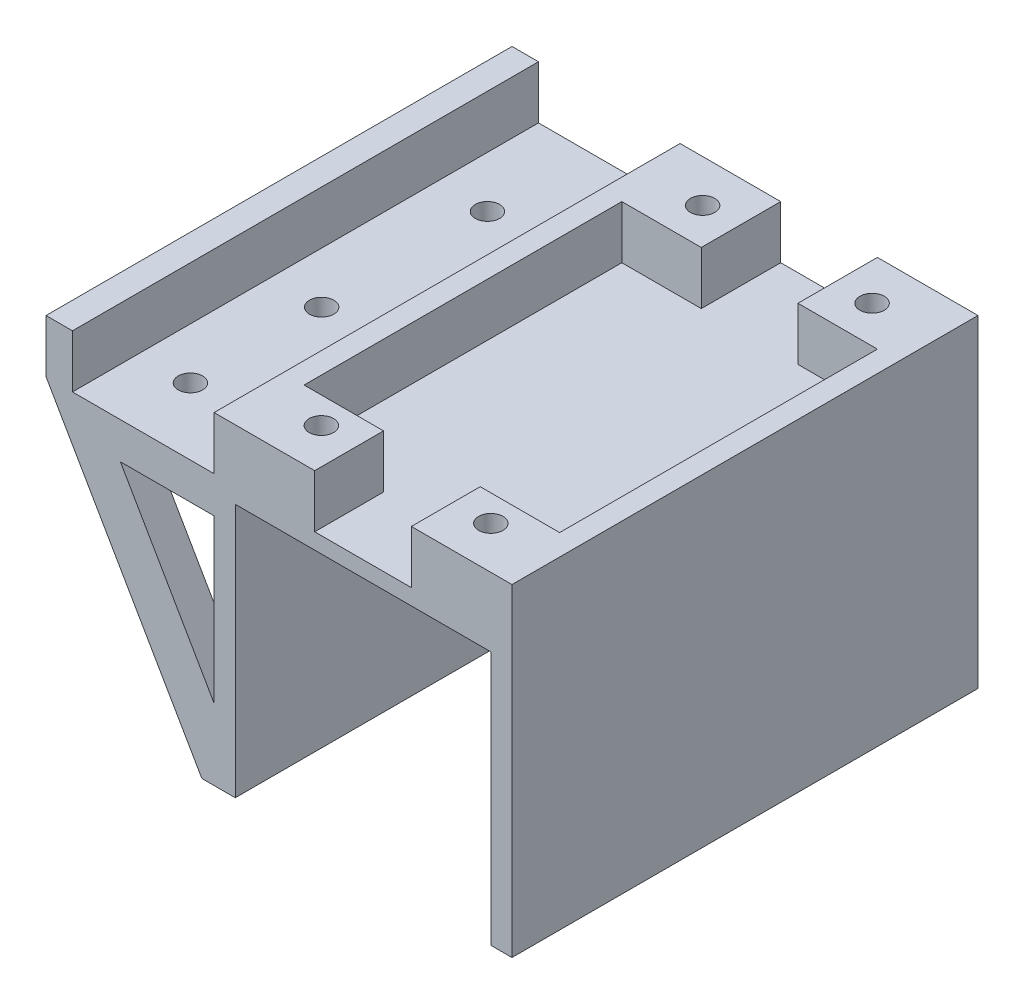
from build123d import *

# Parameters (mm, degrees)
SKETCH1_W            = 48.254
SKETCH1_H            = 10
BOSS_EXTRUDE1_DEPTH  = 70
BOSS_EXTRUDE3_DEPTH  = 8
BOSS_EXTRUDE4_DEPTH  = 8
BOSS_EXTRUDE5_DEPTH  = 8
BOSS_EXTRUDE6_DEPTH  = 70
SKETCH7_W            = 40.394634483
SKETCH7_H            = 17
CUT_EXTRUDE3_DEPTH   = 70
BOSS_EXTRUDE7_DEPTH  = 70
BOSS_EXTRUDE10_DEPTH = 8
BOSS_EXTRUDE11_DEPTH = 70
SKETCH13_W           = 83.001411072
SKETCH13_H           = 87.868559997
CUT_EXTRUDE4_DEPTH   = 4
SKETCH14_W           = 48.254
SKETCH14_H           = 10
BOSS_EXTRUDE12_DEPTH = 20
SKETCH16_W           = 56.254
SKETCH16_H           = 5
CUT_EXTRUDE5_DEPTH   = 100
SKETCH17_W           = 15
SKETCH17_H           = 15
BOSS_EXTRUDE14_DEPTH = 13
CUT_EXTRUDE8_DEPTH   = 5
SKETCH21_R           = 2.3
CUT_EXTRUDE9_DEPTH   = 15
SKETCH23_W           = 12
SKETCH23_H           = 40.530858039
CUT_EXTRUDE10_DEPTH  = 9
SKETCH25_R           = 2.3
CUT_EXTRUDE11_DEPTH  = 20
SKETCH26_R           = 2.3
CUT_EXTRUDE12_DEPTH  = 20
BOSS_EXTRUDE16_DEPTH = 20
SKETCH28_W           = 15
SKETCH28_H           = 15
BOSS_EXTRUDE17_DEPTH = 10
SKETCH29_R           = 2.3
CUT_EXTRUDE13_DEPTH  = 20
SKETCH30_W           = 10.391026801
SKETCH30_H           = 12
BOSS_EXTRUDE18_DEPTH = 5
SKETCH31_R           = 2.3
CUT_EXTRUDE14_DEPTH  = 45
SKETCH36_R           = 60.036471347
CUT_EXTRUDE15_DEPTH  = 2
SKETCH37_W           = 5
SKETCH37_H           = 88
BOSS_EXTRUDE19_DEPTH = 10


with BuildPart() as part:
    # Sketch1 → Boss-Extrude1 (new body)
    with BuildSketch(Plane.XY):
        Polygon((0, 70), (0, 0), (4, 0), (4, 52), (52.254, 52), (52.254, 0), (56.254, 0), (56.254, 70), align=None)
        with Locations((28.127, 60)):
            Rectangle(SKETCH1_W, SKETCH1_H, mode=Mode.SUBTRACT)
    extrude(amount=BOSS_EXTRUDE1_DEPTH)

    # Sketch3 → Boss-Extrude3 (add)
    with BuildSketch(Plane.XY.offset(70)):
        Polygon((0, 62.5), (0, 70), (-40.394634483, 70), (0, 0.034440722), (0, 17.466679003), (-26, 62.5), align=None)
    extrude(amount=-BOSS_EXTRUDE3_DEPTH)

    # Sketch4 → Boss-Extrude4 (add)
    with BuildSketch(Plane(origin=(0, 0, 0), x_dir=(-1, 0, 0), z_dir=(0, 0, -1))):
        Polygon((0, 70), (40.394634483, 70), (0, 0), (0, 17.466679003), (26, 62.5), (0, 62.5), align=None)
    extrude(amount=-BOSS_EXTRUDE4_DEPTH)

    # Sketch5 → Boss-Extrude5 (add)
    with BuildSketch(Plane(origin=(0, 0, 39), x_dir=(-1, 0, 0), z_dir=(0, 0, -1))):
        Polygon((0, 62.5), (0, 70), (40.394634483, 70), (0, 0), (0, 17.466679003), (26, 62.5), align=None)
    extrude(amount=BOSS_EXTRUDE5_DEPTH)

    # Sketch6 → Boss-Extrude6 (add)
    with BuildSketch(Plane(origin=(0, 0, 0), x_dir=(-1, 0, 0), z_dir=(0, 0, -1))):
        Polygon((0, 62.5), (36.066637932, 62.5), (40.394634483, 70), (0, 70), align=None)
        Polygon((-4, 0), (0, 0), (7.50186069, 13), (-4, 13), align=None)
    extrude(amount=-BOSS_EXTRUDE6_DEPTH)

    # Sketch7 → Cut-Extrude3 (cut)
    with BuildSketch(Plane.XY.offset(70)):
        with Locations((-20.197317242, 61.5)):
            Rectangle(SKETCH7_W, SKETCH7_H)
    extrude(amount=-CUT_EXTRUDE3_DEPTH, mode=Mode.SUBTRACT)

    # Sketch8 → Boss-Extrude7 (add)
    with BuildSketch(Plane(origin=(0, 0, 0), x_dir=(-1, 0, 0), z_dir=(0, 0, -1))):
        Polygon((-4, 55), (-4, 52), (30.007442759, 52), (31.73864138, 55), align=None)
    extrude(amount=-BOSS_EXTRUDE7_DEPTH)

    # Sketch11 → Boss-Extrude10 (add)
    with BuildSketch(Plane.XY.offset(70)):
        Polygon((-31.73864138, 55), (0, 0), (-3.053687451, 13), (-27.288965695, 55), align=None)
    extrude(amount=-BOSS_EXTRUDE10_DEPTH)

    # Sketch12 → Boss-Extrude11 (add)
    with BuildSketch(Plane.XY.offset(70)):
        Polygon((-31.73864138, 55), (-27.75981023, 48.105069917), (0, 48.105069917), (0, 55), align=None)
    extrude(amount=-BOSS_EXTRUDE11_DEPTH)

    # Sketch13 → Cut-Extrude4 (cut)
    with BuildSketch(Plane.XZ):
        with Locations((25.938658228, 33.313825886)):
            Rectangle(SKETCH13_W, SKETCH13_H)
    extrude(amount=-CUT_EXTRUDE4_DEPTH, mode=Mode.SUBTRACT)

    # Sketch14 → Boss-Extrude12 (add)
    with BuildSketch(Plane.XY.offset(70)):
        Polygon((-2.308264828, 4), (-31.73864138, 55), (0, 55), (0, 70), (56.254, 70), (56.254, 4), (52.254, 4), (52.254, 52), (4, 52), (4, 4), align=None)
        Polygon((-17.689083241, 48.105069917), (0, 48.105069917), (0, 17.466679003), align=None, mode=Mode.SUBTRACT)
        with Locations((28.127, 60)):
            Rectangle(SKETCH14_W, SKETCH14_H, mode=Mode.SUBTRACT)
    extrude(amount=BOSS_EXTRUDE12_DEPTH)

    # Sketch16 → Cut-Extrude5 (cut)
    with BuildSketch(Plane.XY.offset(90)):
        with Locations((28.127, 67.5)):
            Rectangle(SKETCH16_W, SKETCH16_H)
    extrude(amount=-CUT_EXTRUDE5_DEPTH, mode=Mode.SUBTRACT)

    # Sketch17 → Boss-Extrude14 (add)
    with BuildSketch(Plane(origin=(0, 65, 0), x_dir=(1, 0, 0), z_dir=(0, 1, 0))):
        with Locations((44.754, -7.5)):
            Rectangle(SKETCH17_W, SKETCH17_H)
        with Locations((44.754, -82.5)):
            Rectangle(SKETCH17_W, SKETCH17_H)
    extrude(amount=-BOSS_EXTRUDE14_DEPTH)

    # Sketch22 → Cut-Extrude8 (cut)
    with BuildSketch(Plane.XZ.offset(-52)):
        Polygon((48.096455918, 6.003620146), (47.904143628, 10.329474511), (44.06168771, 12.325854365), (40.411544082, 9.996379854), (40.603856372, 5.670525489), (44.44631229, 3.674145635), align=None)
        Polygon((45.200685086, 75.774625774), (48.386623963, 78.707166221), (47.439938877, 82.932540447), (43.307314914, 84.225374226), (40.121376037, 81.292833779), (41.068061123, 77.067459553), align=None)
    extrude(amount=-CUT_EXTRUDE8_DEPTH, mode=Mode.SUBTRACT)

    # Sketch21 → Cut-Extrude9 (cut)
    with BuildSketch(Plane(origin=(0, 52, 0), x_dir=(-1, 0, 0), z_dir=(0, -1, 0))):
        with Locations((-44.254, -80)):
            Circle(SKETCH21_R)
        with Locations((-44.254, -8)):
            Circle(SKETCH21_R)
    extrude(amount=-CUT_EXTRUDE9_DEPTH, mode=Mode.SUBTRACT)

    # Sketch23 → Cut-Extrude10 (cut)
    with BuildSketch(Plane(origin=(0, 0, 0), x_dir=(0, 0, 1), z_dir=(-0.8661319205837115, -0.49981546209173167, 0))):
        with Locations((76, 35.274689955)):
            Rectangle(SKETCH23_W, SKETCH23_H)
    extrude(amount=-CUT_EXTRUDE10_DEPTH, mode=Mode.SUBTRACT)

    # Sketch25 → Cut-Extrude11 (cut)
    with BuildSketch(Plane(origin=(0, 48.105069917, 0), x_dir=(-1, 0, 0), z_dir=(0, -1, 0))):
        with Locations((17.075514089, -19.30064897)):
            Circle(SKETCH25_R)
        with Locations((17.075514089, -50.613733273)):
            Circle(SKETCH25_R)
    extrude(amount=-CUT_EXTRUDE11_DEPTH, mode=Mode.SUBTRACT)

    # Sketch26 → Cut-Extrude12 (cut)
    with BuildSketch(Plane.XZ.offset(-48.105069917)):
        with Locations((-17.075514089, 75.391336138)):
            Circle(SKETCH26_R)
    extrude(amount=-CUT_EXTRUDE12_DEPTH, mode=Mode.SUBTRACT)

    # Sketch27 → Boss-Extrude16 (add)
    with BuildSketch(Plane.XY.offset(90)):
        Polygon((-23.310381194, 48.105069917), (-27.75981023, 48.105069917), (-31.73864138, 55), (-23.310381194, 55), align=None)
    extrude(amount=-BOSS_EXTRUDE16_DEPTH)

    # Sketch28 → Boss-Extrude17 (add)
    with BuildSketch(Plane(origin=(0, 55, 0), x_dir=(1, 0, 0), z_dir=(0, 1, 0))):
        with Locations((11.5, -7.5)):
            Rectangle(SKETCH28_W, SKETCH28_H)
        with Locations((11.5, -82.5)):
            Rectangle(SKETCH28_W, SKETCH28_H)
    extrude(amount=BOSS_EXTRUDE17_DEPTH)

    # Sketch29 → Cut-Extrude13 (cut)
    with BuildSketch(Plane(origin=(0, 52, 0), x_dir=(-1, 0, 0), z_dir=(0, -1, 0))):
        with Locations((-12.254, -8)):
            Circle(SKETCH29_R)
        with Locations((-12.254, -80)):
            Circle(SKETCH29_R)
    extrude(amount=-CUT_EXTRUDE13_DEPTH, mode=Mode.SUBTRACT)

    # Sketch30 → Boss-Extrude18 (add)
    with BuildSketch(Plane.XZ.offset(-48.105069917)):
        with Locations((-22.56429683, 76)):
            Rectangle(SKETCH30_W, SKETCH30_H)
    extrude(amount=-BOSS_EXTRUDE18_DEPTH)

    # Sketch31 → Cut-Extrude14 (cut)
    with BuildSketch(Plane.XZ.offset(-48.105069917)):
        with Locations((-17.075514089, 75.391336138)):
            Circle(SKETCH31_R)
    extrude(amount=-CUT_EXTRUDE14_DEPTH, mode=Mode.SUBTRACT)

    # Sketch36 → Cut-Extrude15 (cut)
    with BuildSketch(Plane.XY.offset(90)):
        with Locations((23.036116276, 36.93280147)):
            Circle(SKETCH36_R)
    extrude(amount=-CUT_EXTRUDE15_DEPTH, mode=Mode.SUBTRACT)

    # Sketch37 → Boss-Extrude19 (add)
    with BuildSketch(Plane(origin=(0, 55, 0), x_dir=(1, 0, 0), z_dir=(0, 1, 0))):
        with Locations((-29.23864138, -44)):
            Rectangle(SKETCH37_W, SKETCH37_H)
    extrude(amount=BOSS_EXTRUDE19_DEPTH)


solid = part.part
